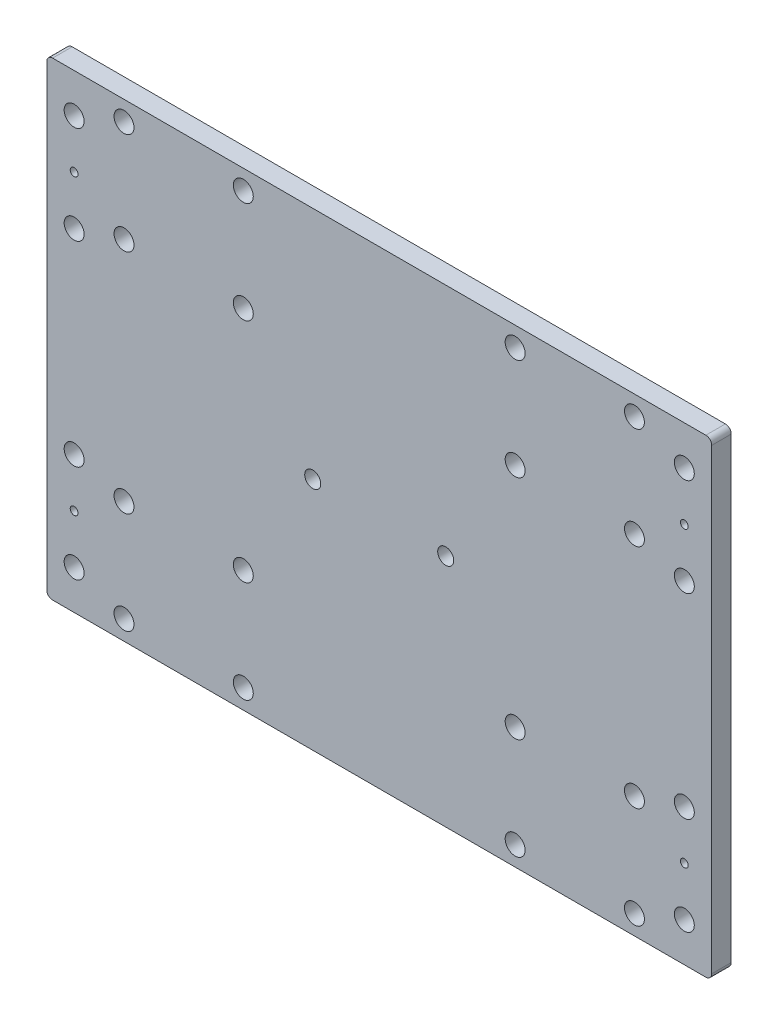
from build123d import *

# Parameters (mm, degrees)
SKETCH1_W           = 170
SKETCH1_H           = 120
BOSS_EXTRUDE1_DEPTH = 2.5
SKETCH2_R           = 2.55
CUT_EXTRUDE1_DEPTH  = 105.16333328
SKETCH4_R           = 2.05
CUT_EXTRUDE3_DEPTH  = 105.16333328
FILLET1_R           = 1.5
SKETCH6_R           = 2.55
SKETCH6_R_2         = 1
CUT_EXTRUDE5_DEPTH  = 105.16333328


with BuildPart() as part:
    # Sketch1 → Boss-Extrude1 (new, symmetric)
    with BuildSketch(Plane.XY):
        Rectangle(SKETCH1_W, SKETCH1_H)
    extrude(amount=BOSS_EXTRUDE1_DEPTH, both=True)

    # Sketch2 → Cut-Extrude1 (cut, through all)
    with BuildSketch(Plane.XY.offset(2.5)):
        with Locations((-65.25, 55)):
            Circle(SKETCH2_R)
        with Locations((-34.75, 55)):
            Circle(SKETCH2_R)
        with Locations((-34.75, 29)):
            Circle(SKETCH2_R)
        with Locations((-65.25, 29)):
            Circle(SKETCH2_R)
        with Locations((65.25, 55)):
            Circle(SKETCH2_R)
        with Locations((65.25, 29)):
            Circle(SKETCH2_R)
        with Locations((34.75, 29)):
            Circle(SKETCH2_R)
        with Locations((34.75, 55)):
            Circle(SKETCH2_R)
        with Locations((-65.25, -29)):
            Circle(SKETCH2_R)
        with Locations((-34.75, -29)):
            Circle(SKETCH2_R)
        with Locations((-34.75, -55)):
            Circle(SKETCH2_R)
        with Locations((-65.25, -55)):
            Circle(SKETCH2_R)
        with Locations((34.75, -29)):
            Circle(SKETCH2_R)
        with Locations((65.25, -29)):
            Circle(SKETCH2_R)
        with Locations((65.25, -55)):
            Circle(SKETCH2_R)
        with Locations((34.75, -55)):
            Circle(SKETCH2_R)
    extrude(amount=-CUT_EXTRUDE1_DEPTH, mode=Mode.SUBTRACT)

    # Sketch4 → Cut-Extrude3 (cut, through all)
    with BuildSketch(Plane.XY.offset(2.5)):
        with Locations((-17, 0)):
            Circle(SKETCH4_R)
        with Locations((17, 0)):
            Circle(SKETCH4_R)
    extrude(amount=-CUT_EXTRUDE3_DEPTH, mode=Mode.SUBTRACT)

    # Fillet1
    fillet1_edges = [part.edges().sort_by_distance(p)[0] for p in [
        (-85, -60, 0),
        (85, -60, 0),
        (85, 60, 0),
        (-85, 60, 0),
    ]]
    fillet(fillet1_edges, radius=FILLET1_R)

    # Sketch6 → Cut-Extrude5 (cut, through all)
    with BuildSketch(Plane.XY.offset(2.5)):
        with Locations((-78, 50)):
            Circle(SKETCH6_R)
        with Locations((-78, 37.5)):
            Circle(SKETCH6_R_2)
        with Locations((-78, 25)):
            Circle(SKETCH6_R)
        with Locations((-78, -25)):
            Circle(SKETCH6_R)
        with Locations((-78, -37.5)):
            Circle(SKETCH6_R_2)
        with Locations((-78, -50)):
            Circle(SKETCH6_R)
    cut_extrude5 = extrude(amount=-CUT_EXTRUDE5_DEPTH, mode=Mode.SUBTRACT)

    # Mirror1: Cut-Extrude5 across plane
    add(cut_extrude5.mirror(Plane(origin=(0, 0, 0), x_dir=(0, 0, 1), z_dir=(1, 0, 0))), mode=Mode.SUBTRACT)


solid = part.part
